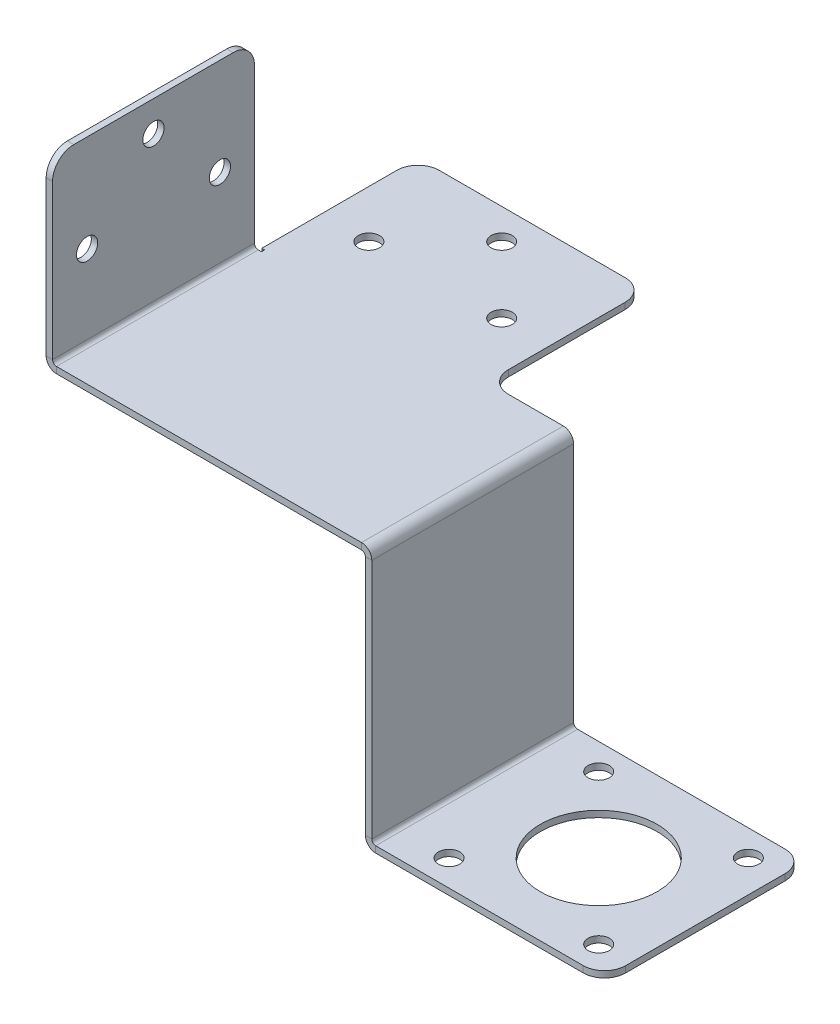
from build123d import *

# Parameters (mm, degrees)
BRIDA_BASE1_DEPTH                = 1.2
BRIDA_START                      = -19
BRIDA_DE_ARISTA1_DEPTH           = 38
BRIDA_START_2                    = -19.6
BRIDA_DE_ARISTA1_2_OUTLINE_W     = 0.5366
BRIDA_DE_ARISTA1_2_OUTLINE_H     = 1.2
BRIDA_DE_ARISTA1_2_DEPTH         = 0.6
BRIDA_DE_ARISTA1_3_DEPTH         = 38
CROQUIS12_R                      = 2
CORTAR_EXTRUIR1_DEPTH            = 1.2
CROQUIS15_R                      = 2
CORTAR_EXTRUIR3_DEPTH            = 1.2
REDONDEO3_R                      = 4
BRIDA_DE_ARISTA2_STRIP_W         = 6.3732
BRIDA_DE_ARISTA2_STRIP_H         = 1.2
BRIDA_DE_ARISTA2_STRIP_CUT_DEPTH = 38
BRIDA_DE_ARISTA2_DEPTH           = 38
BRIDA_DE_ARISTA3_STRIP_W         = 6.3732
BRIDA_DE_ARISTA3_STRIP_H         = 1.2
BRIDA_DE_ARISTA3_STRIP_CUT_DEPTH = 38
BRIDA_DE_ARISTA3_DEPTH           = 38
CROQUIS22_R                      = 2
CROQUIS22_R_2                    = 11
CORTAR_EXTRUIR4_DEPTH            = 1.2
REDONDEO4_R                      = 4


# Read off the part's stored shape, not the designer's step: Brida de arista1
# Sheet-metal steps are written as plain solids
with BuildPart() as part:
    # Croquis1 → Brida base1 (new body)
    with BuildSketch(Plane(origin=(0, 0, 0), x_dir=(1, 0, 0), z_dir=(0, 1, 0))):
        Polygon((-30, -19), (30, -19), (30, 19), (15, 19), (15, 49), (-28, 49), (-28, 19), (-30, 19), align=None)
    extrude(amount=-BRIDA_BASE1_DEPTH)

    # Brida de arista1 outline → Brida de arista1 (cut)
    with BuildSketch(Plane.XY.offset(BRIDA_START)):
        with BuildLine():
            Line((-30, -1.2), (-28.0634, -1.2))
            ThreePointArc((-28.0634, -1.2), (-29.141342484, -0.872269031), (-29.854444388, 0))
            Line((-29.854444388, 0), (-30, 0))
            Line((-30, 0), (-30, -1.2))
        make_face()
    extrude(amount=BRIDA_DE_ARISTA1_DEPTH, mode=Mode.SUBTRACT)

    # Brida de arista1 2 outline → Brida de arista1 2 (cut)
    with BuildSketch(Plane.XY.offset(BRIDA_START_2)):
        with Locations((-27.7317, -0.6)):
            Rectangle(BRIDA_DE_ARISTA1_2_OUTLINE_W, BRIDA_DE_ARISTA1_2_OUTLINE_H)
    extrude(amount=BRIDA_DE_ARISTA1_2_DEPTH, mode=Mode.SUBTRACT)

    # Brida de arista1 3 outline → Brida de arista1 3 (add)
    with BuildSketch(Plane.XY.offset(BRIDA_START)):
        with BuildLine():
            Line((-29.854444388, 0), (-28.0634, 0))
            ThreePointArc((-28.0634, 0), (-28.584254855, 0.215745145), (-28.8, 0.7366))
            Line((-28.8, 0.7366), (-28.8, 33.8))
            Line((-28.8, 33.8), (-30, 33.8))
            Line((-30, 33.8), (-30, 0.7366))
            ThreePointArc((-30, 0.7366), (-29.963262642, 0.361178238), (-29.854444388, 0))
        make_face()
    extrude(amount=BRIDA_DE_ARISTA1_3_DEPTH)

    # Croquis12 → Cortar-Extruir1 (cut)
    with BuildSketch(Plane(origin=(0, 0, 0), x_dir=(1, 0, 0), z_dir=(0, 1, 0))):
        with Locations(Location((6, 30.75, 0), (0, 0, 270))):
            Circle(CROQUIS12_R)
        with Locations(Location((-19, 30.75, 0), (0, 0, 270))):
            Circle(CROQUIS12_R)
        with Locations(Location((-6.5, 43.25, 0), (0, 0, 270))):
            Circle(CROQUIS12_R)
    extrude(amount=-CORTAR_EXTRUIR1_DEPTH, mode=Mode.SUBTRACT)

    # Croquis15 → Cortar-Extruir3 (cut)
    with BuildSketch(Plane.ZY.offset(30)):
        with Locations(Location((-12.5, 15.55, 0), (0, 0, 270))):
            Circle(CROQUIS15_R)
        with Locations(Location((12.5, 15.55, 0), (0, 0, 270))):
            Circle(CROQUIS15_R)
        with Locations(Location((0, 28.05, 0), (0, 0, 270))):
            Circle(CROQUIS15_R)
    extrude(amount=-CORTAR_EXTRUIR3_DEPTH, mode=Mode.SUBTRACT)

    # Redondeo3
    redondeo3_edges = [part.edges().sort_by_distance(p)[0] for p in [
        (-28, -0.6, -49),
        (15, -0.6, -49),
        (15, -0.6, -19),
        (-29.4, 33.8, -19),
        (-29.4, 33.8, 19),
    ]]
    fillet(redondeo3_edges, radius=REDONDEO3_R)

    # Brida de arista2 strip (across the edge) → Brida de arista2 strip cut (cut)
    with BuildSketch(Plane(origin=(30.1, -1.2, -19), x_dir=(-1, 0, 0), z_dir=(0, 0, 1))):
        with Locations((-2.45, -0.6)):
            Rectangle(BRIDA_DE_ARISTA2_STRIP_W, BRIDA_DE_ARISTA2_STRIP_H)
    extrude(amount=BRIDA_DE_ARISTA2_STRIP_CUT_DEPTH, mode=Mode.SUBTRACT)

    # Brida de arista2 section (across the edge) → Brida de arista2 (add)
    with BuildSketch(Plane(origin=(30.1, -1.2, -19), x_dir=(-1, 0, 0), z_dir=(0, 0, 1))):
        with BuildLine():
            Line((-1.2, 0.7366), (-1.2, 46.8))
            Line((-1.2, 46.8), (0, 46.8))
            Line((0, 46.8), (0, 0.7366))
            ThreePointArc((0, 0.7366), (0.215745145, 0.215745145), (0.7366, 0))
            Line((0.7366, 0), (0.7366, -1.2))
            ThreePointArc((0.7366, -1.2), (-0.632782992, -0.632782992), (-1.2, 0.7366))
        make_face()
    extrude(amount=BRIDA_DE_ARISTA2_DEPTH)

    # Brida de arista3 strip (across the edge) → Brida de arista3 strip cut (cut)
    with BuildSketch(Plane(origin=(31.3, -48.1, 19), x_dir=(0, 1, 0), z_dir=(0, 0, -1))):
        with Locations((-2.45, -0.6)):
            Rectangle(BRIDA_DE_ARISTA3_STRIP_W, BRIDA_DE_ARISTA3_STRIP_H)
    extrude(amount=BRIDA_DE_ARISTA3_STRIP_CUT_DEPTH, mode=Mode.SUBTRACT)

    # Brida de arista3 section (across the edge) → Brida de arista3 (add)
    with BuildSketch(Plane(origin=(31.3, -48.1, 19), x_dir=(0, 1, 0), z_dir=(0, 0, -1))):
        with BuildLine():
            Line((-1.2, 0.7366), (-1.2, 43.8))
            Line((-1.2, 43.8), (0, 43.8))
            Line((0, 43.8), (0, 0.7366))
            ThreePointArc((0, 0.7366), (0.215745145, 0.215745145), (0.7366, 0))
            Line((0.7366, 0), (0.7366, -1.2))
            ThreePointArc((0.7366, -1.2), (-0.632782992, -0.632782992), (-1.2, 0.7366))
        make_face()
    extrude(amount=BRIDA_DE_ARISTA3_DEPTH)

    # Croquis22 → Cortar-Extruir4 (cut)
    with BuildSketch(Plane(origin=(0, -48.1, 0), x_dir=(1, 0, 0), z_dir=(0, 1, 0))):
        with Locations(Location((69.1, -14.085, 0), (0, 0, 270))):
            Circle(CROQUIS22_R)
        with Locations(Location((40.93, -14.085, 0), (0, 0, 270))):
            Circle(CROQUIS22_R)
        with Locations(Location((69.1, 14.085, 0), (0, 0, 270))):
            Circle(CROQUIS22_R)
        with Locations(Location((40.93, 14.085, 0), (0, 0, 270))):
            Circle(CROQUIS22_R)
        with Locations(Location((55.015, 0, 0), (0, 0, 270))):
            Circle(CROQUIS22_R_2)
    extrude(amount=-CORTAR_EXTRUIR4_DEPTH, mode=Mode.SUBTRACT)

    # Redondeo4
    redondeo4_edges = [part.edges().sort_by_distance(p)[0] for p in [
        (75.1, -48.7, 19),
        (75.1, -48.7, -19),
    ]]
    fillet(redondeo4_edges, radius=REDONDEO4_R)


solid = part.part
